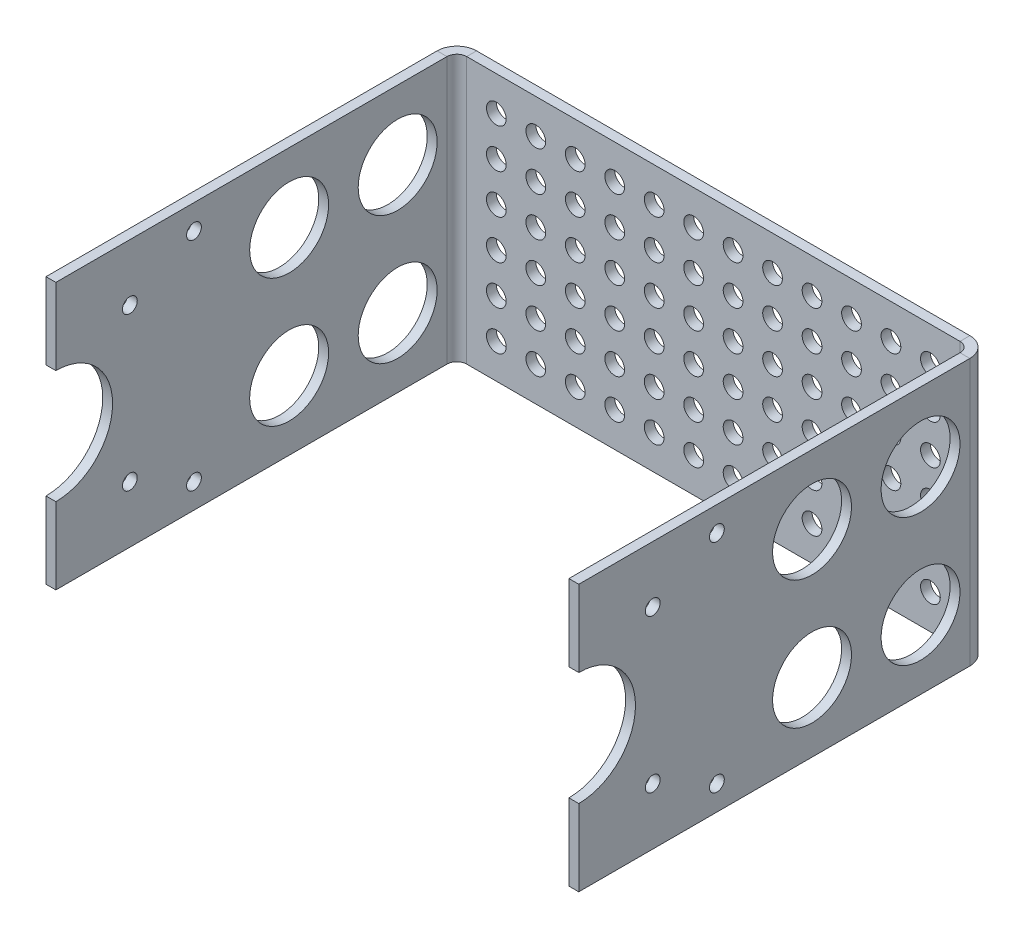
from build123d import *
from build123d.topology import SkipClean

# Parameters (mm, degrees)
DODANIE_WYCI_GNI_CIE2_DEPTH = 2
SZKIC_START                 = -29.723292371
SZKIC_ZGI_CIA2_DEPTH        = 54
SZKIC_ZGI_CIA2_2_DEPTH      = 54
SZKIC_START_2               = -53.387814563
SZKIC_ZGI_CIA2_3_DEPTH      = 2
SZKIC_ZGI_CIA3_DEPTH        = 54
SZKIC_ZGI_CIA3_2_DEPTH      = 15.5
SZKIC_START_3               = 8.776707629
SZKIC_ZGI_CIA3_3_DEPTH      = 15.5
SZKIC_START_4               = 50.91654951
SZKIC_ZGI_CIA3_4_DEPTH      = 3.695635927
SZKIC_START_5               = -14.223292371
SZKIC_ZGI_CIA3_5_DEPTH      = 23
SZKIC_ZGI_CIA3_6_DEPTH      = 23
SZKIC15_R                   = 2
WYTNIJ_WYCI_GNI_CIE1_DEPTH  = 103.340806205
SZKIC17_R                   = 8
WYTNIJ_WYCI_GNI_CIE2_DEPTH  = 140.586175041
SZKIC18_R                   = 1.5
WYTNIJ_WYCI_GNI_CIE3_DEPTH  = 140.586175041


with BuildPart() as part:
    # Szkic1 → Dodanie-wyciągnięcie2 (new body)
    with BuildSketch(Plane.XY):
        with BuildLine():
            Line((-133.387814563, 24.276707629), (-133.387814563, 8.776707629))
            ThreePointArc((-133.387814563, 8.776707629), (-121.887814563, -2.723292371), (-133.387814563, -14.223292371))
            Line((-133.387814563, -14.223292371), (-133.387814563, -29.723292371))
            Line((-133.387814563, -29.723292371), (134.612185437, -29.723292371))
            Line((134.612185437, -29.723292371), (134.612185437, -14.223292371))
            ThreePointArc((134.612185437, -14.223292371), (123.112185437, -2.723292371), (134.612185437, 8.776707629))
            Line((134.612185437, 8.776707629), (134.612185437, 24.276707629))
            Line((134.612185437, 24.276707629), (-133.387814563, 24.276707629))
        make_face()
    extrude(amount=DODANIE_WYCI_GNI_CIE2_DEPTH)

    # Szkic zgięcia2: read off the stored shape, not the designer's step
    # Szkic zgięcia2 outline → Szkic zgięcia2 (cut)
    with BuildSketch(Plane(origin=(0, 0, 0), x_dir=(1, 0, 0), z_dir=(0, 1, 0)).offset(SZKIC_START)):
        with BuildLine():
            Line((-133.387814563, -2), (-52.851916179, -2))
            ThreePointArc((-52.851916179, -2), (-51.387814563, -0.535898385), (-49.387814563, 0))
            Line((-49.387814563, 0), (-133.387814563, 0))
            Line((-133.387814563, 0), (-133.387814563, -2))
        make_face()
    extrude(amount=SZKIC_ZGI_CIA2_DEPTH, mode=Mode.SUBTRACT)

    # Szkic zgi_cia2 2 outline → Szkic zgi_cia2 2 (add)
    with BuildSketch(Plane(origin=(0, 0, 0), x_dir=(1, 0, 0), z_dir=(0, 1, 0)).offset(SZKIC_START)):
        with BuildLine():
            Line((-53.387814563, -83.28761102), (-51.387814563, -83.28761102))
            Line((-51.387814563, -83.28761102), (-51.387814563, -4))
            ThreePointArc((-51.387814563, -4), (-50.802028126, -2.585786437), (-49.387814563, -2))
            Line((-49.387814563, -2), (-52.851916179, -2))
            ThreePointArc((-52.851916179, -2), (-53.251517868, -2.96472382), (-53.387814563, -4))
            Line((-53.387814563, -4), (-53.387814563, -83.28761102))
        make_face()
    extrude(amount=SZKIC_ZGI_CIA2_2_DEPTH)

    # Szkic zgi_cia2 3 outline → Szkic zgi_cia2 3 (cut)
    with BuildSketch(Plane.YZ.offset(SZKIC_START_2)):
        with BuildLine():
            ThreePointArc((-14.223292371, 83.28761102), (-2.723292371, 71.78761102), (8.776707629, 83.28761102))
            Line((8.776707629, 83.28761102), (-14.223292371, 83.28761102))
        make_face()
    extrude(amount=SZKIC_ZGI_CIA2_3_DEPTH, mode=Mode.SUBTRACT)

    # Szkic zgięcia3: read off the stored shape, not the designer's step
    # Szkic zgięcia3 outline → Szkic zgięcia3 (cut)
    with BuildSketch(Plane(origin=(0, 0, 0), x_dir=(1, 0, 0), z_dir=(0, 1, 0)).offset(SZKIC_START)):
        with BuildLine():
            ThreePointArc((50.612185437, 0), (52.612185437, -0.535898385), (54.076287052, -2))
            Line((54.076287052, -2), (134.612185437, -2))
            Line((134.612185437, -2), (134.612185437, 0))
            Line((134.612185437, 0), (50.612185437, 0))
        make_face()
    extrude(amount=SZKIC_ZGI_CIA3_DEPTH, mode=Mode.SUBTRACT)

    # Szkic zgi_cia3 2 outline → Szkic zgi_cia3 2 (add)
    with BuildSketch(Plane(origin=(0, 0, 0), x_dir=(1, 0, 0), z_dir=(0, 1, 0)).offset(SZKIC_START)):
        with BuildLine():
            Line((52.612185437, -4), (52.612185437, -83.28761102))
            Line((52.612185437, -83.28761102), (54.612185437, -83.28761102))
            Line((54.612185437, -83.28761102), (54.612185437, -4))
            ThreePointArc((54.612185437, -4), (54.475888742, -2.96472382), (54.076287052, -2))
            Line((54.076287052, -2), (50.612185437, -2))
            ThreePointArc((50.612185437, -2), (52.026398999, -2.585786438), (52.612185437, -4))
        make_face()
    extrude(amount=SZKIC_ZGI_CIA3_2_DEPTH)

    # Szkic zgi_cia3 3 outline → Szkic zgi_cia3 3 (add)
    with BuildSketch(Plane(origin=(0, 0, 0), x_dir=(1, 0, 0), z_dir=(0, 1, 0)).offset(SZKIC_START_3)):
        with BuildLine():
            Line((52.612185437, -4), (52.612185437, -83.28761102))
            Line((52.612185437, -83.28761102), (54.612185437, -83.28761102))
            Line((54.612185437, -83.28761102), (54.612185437, -4))
            ThreePointArc((54.612185437, -4), (54.475888742, -2.96472382), (54.076287052, -2))
            Line((54.076287052, -2), (50.612185437, -2))
            ThreePointArc((50.612185437, -2), (52.026398999, -2.585786438), (52.612185437, -4))
        make_face()
    extrude(amount=SZKIC_ZGI_CIA3_3_DEPTH)

    # Szkic zgi_cia3 4 outline → Szkic zgi_cia3 4 (add)
    with BuildSketch(Plane.YZ.offset(SZKIC_START_4)):
        with BuildLine():
            ThreePointArc((8.776707629, 83.28761102), (-2.723292371, 71.78761102), (-14.223292371, 83.28761102))
            Line((-14.223292371, 83.28761102), (-14.223292371, 2))
            Line((-14.223292371, 2), (8.776707629, 2))
            Line((8.776707629, 2), (8.776707629, 83.28761102))
        make_face()
    extrude(amount=SZKIC_ZGI_CIA3_4_DEPTH)

    # Szkic zgi_cia3 5 outline → Szkic zgi_cia3 5 (cut)
    with SkipClean():  # the faces are left unmerged after this step: merging them gives an invalid solid
        with BuildSketch(Plane(origin=(0, 0, 0), x_dir=(1, 0, 0), z_dir=(0, 1, 0)).offset(SZKIC_START_5)):
            with BuildLine():
                Line((52.612185437, -85), (52.612185437, -4))
                ThreePointArc((52.612185437, -4), (52.130198636, -2.69783414), (50.91654951, -2.023295037))
                Line((50.91654951, -2.023295037), (50.91654951, -85))
                Line((50.91654951, -85), (52.612185437, -85))
            make_face()
            with BuildLine():
                Line((56, -2), (54.076287052, -2))
                ThreePointArc((54.076287052, -2), (54.475888742, -2.96472382), (54.612185437, -4))
                Line((54.612185437, -4), (54.612185454, -85))
                Line((54.612185454, -85), (56, -85))
                Line((56, -85), (56, -2))
            make_face()
        extrude(amount=SZKIC_ZGI_CIA3_5_DEPTH, mode=Mode.SUBTRACT)

    # Szkic zgi_cia3 6 outline → Szkic zgi_cia3 6 (add)
    with SkipClean():  # the faces are left unmerged after this step: merging them gives an invalid solid
        with BuildSketch(Plane(origin=(0, 0, 0), x_dir=(1, 0, 0), z_dir=(0, 1, 0)).offset(SZKIC_START_5)):
            with BuildLine():
                ThreePointArc((50.612185437, -2), (50.764812554, -2.005832263), (50.91654951, -2.023295037))
                Line((50.91654951, -2.023295037), (50.91654951, -2))
                Line((50.91654951, -2), (50.612185437, -2))
            make_face()
        extrude(amount=SZKIC_ZGI_CIA3_6_DEPTH)

    # Szkic15 → Wytnij-wyciągnięcie1 (cut, through all)
    with SkipClean():  # the faces are left unmerged after this step: merging them gives an invalid solid
        with BuildSketch(Plane.XY.offset(2)):
            with Locations((-43.387814563, 17.276707629)):
                Circle(SZKIC15_R)
            with Locations((-35.387814563, 17.276707629)):
                Circle(SZKIC15_R)
            with Locations((-27.387814563, 17.276707629)):
                Circle(SZKIC15_R)
            with Locations((-19.387814563, 17.276707629)):
                Circle(SZKIC15_R)
            with Locations((-11.387814563, 17.276707629)):
                Circle(SZKIC15_R)
            with Locations((-3.387814563, 17.276707629)):
                Circle(SZKIC15_R)
            with Locations((4.612185437, 17.276707629)):
                Circle(SZKIC15_R)
            with Locations((12.612185437, 17.276707629)):
                Circle(SZKIC15_R)
            with Locations((20.612185437, 17.276707629)):
                Circle(SZKIC15_R)
            with Locations((28.612185437, 17.276707629)):
                Circle(SZKIC15_R)
            with Locations((36.612185437, 17.276707629)):
                Circle(SZKIC15_R)
            with Locations((44.612185437, 17.276707629)):
                Circle(SZKIC15_R)
            with Locations((-35.387814563, 9.276707629)):
                Circle(SZKIC15_R)
            with Locations((-27.387814563, 9.276707629)):
                Circle(SZKIC15_R)
            with Locations((-19.387814563, 9.276707629)):
                Circle(SZKIC15_R)
            with Locations((-11.387814563, 9.276707629)):
                Circle(SZKIC15_R)
            with Locations((-3.387814563, 9.276707629)):
                Circle(SZKIC15_R)
            with Locations((4.612185437, 9.276707629)):
                Circle(SZKIC15_R)
            with Locations((12.612185437, 9.276707629)):
                Circle(SZKIC15_R)
            with Locations((20.612185437, 9.276707629)):
                Circle(SZKIC15_R)
            with Locations((28.612185437, 9.276707629)):
                Circle(SZKIC15_R)
            with Locations((36.612185437, 9.276707629)):
                Circle(SZKIC15_R)
            with Locations((44.612185437, 9.276707629)):
                Circle(SZKIC15_R)
            with Locations((-35.387814563, 1.276707629)):
                Circle(SZKIC15_R)
            with Locations((-27.387814563, 1.276707629)):
                Circle(SZKIC15_R)
            with Locations((-19.387814563, 1.276707629)):
                Circle(SZKIC15_R)
            with Locations((-11.387814563, 1.276707629)):
                Circle(SZKIC15_R)
            with Locations((-3.387814563, 1.276707629)):
                Circle(SZKIC15_R)
            with Locations((4.612185437, 1.276707629)):
                Circle(SZKIC15_R)
            with Locations((12.612185437, 1.276707629)):
                Circle(SZKIC15_R)
            with Locations((20.612185437, 1.276707629)):
                Circle(SZKIC15_R)
            with Locations((28.612185437, 1.276707629)):
                Circle(SZKIC15_R)
            with Locations((36.612185437, 1.276707629)):
                Circle(SZKIC15_R)
            with Locations((44.612185437, 1.276707629)):
                Circle(SZKIC15_R)
            with Locations((-35.387814563, -6.723292371)):
                Circle(SZKIC15_R)
            with Locations((-27.387814563, -6.723292371)):
                Circle(SZKIC15_R)
            with Locations((-19.387814563, -6.723292371)):
                Circle(SZKIC15_R)
            with Locations((-11.387814563, -6.723292371)):
                Circle(SZKIC15_R)
            with Locations((-3.387814563, -6.723292371)):
                Circle(SZKIC15_R)
            with Locations((4.612185437, -6.723292371)):
                Circle(SZKIC15_R)
            with Locations((12.612185437, -6.723292371)):
                Circle(SZKIC15_R)
            with Locations((20.612185437, -6.723292371)):
                Circle(SZKIC15_R)
            with Locations((28.612185437, -6.723292371)):
                Circle(SZKIC15_R)
            with Locations((36.612185437, -6.723292371)):
                Circle(SZKIC15_R)
            with Locations((44.612185437, -6.723292371)):
                Circle(SZKIC15_R)
            with Locations((-35.387814563, -14.723292371)):
                Circle(SZKIC15_R)
            with Locations((-27.387814563, -14.723292371)):
                Circle(SZKIC15_R)
            with Locations((-19.387814563, -14.723292371)):
                Circle(SZKIC15_R)
            with Locations((-11.387814563, -14.723292371)):
                Circle(SZKIC15_R)
            with Locations((-3.387814563, -14.723292371)):
                Circle(SZKIC15_R)
            with Locations((4.612185437, -14.723292371)):
                Circle(SZKIC15_R)
            with Locations((12.612185437, -14.723292371)):
                Circle(SZKIC15_R)
            with Locations((20.612185437, -14.723292371)):
                Circle(SZKIC15_R)
            with Locations((28.612185437, -14.723292371)):
                Circle(SZKIC15_R)
            with Locations((36.612185437, -14.723292371)):
                Circle(SZKIC15_R)
            with Locations((44.612185437, -14.723292371)):
                Circle(SZKIC15_R)
            with Locations((-35.387814563, -22.723292371)):
                Circle(SZKIC15_R)
            with Locations((-27.387814563, -22.723292371)):
                Circle(SZKIC15_R)
            with Locations((-19.387814563, -22.723292371)):
                Circle(SZKIC15_R)
            with Locations((-11.387814563, -22.723292371)):
                Circle(SZKIC15_R)
            with Locations((-3.387814563, -22.723292371)):
                Circle(SZKIC15_R)
            with Locations((4.612185437, -22.723292371)):
                Circle(SZKIC15_R)
            with Locations((12.612185437, -22.723292371)):
                Circle(SZKIC15_R)
            with Locations((20.612185437, -22.723292371)):
                Circle(SZKIC15_R)
            with Locations((28.612185437, -22.723292371)):
                Circle(SZKIC15_R)
            with Locations((36.612185437, -22.723292371)):
                Circle(SZKIC15_R)
            with Locations((44.612185437, -22.723292371)):
                Circle(SZKIC15_R)
            with Locations((-43.387814563, 9.276707629)):
                Circle(SZKIC15_R)
            with Locations((-43.387814563, 1.276707629)):
                Circle(SZKIC15_R)
            with Locations((-43.387814563, -6.723292371)):
                Circle(SZKIC15_R)
            with Locations((-43.387814563, -14.723292371)):
                Circle(SZKIC15_R)
            with Locations((-43.387814563, -22.723292371)):
                Circle(SZKIC15_R)
        extrude(amount=-WYTNIJ_WYCI_GNI_CIE1_DEPTH, mode=Mode.SUBTRACT)

    # Szkic17 → Wytnij-wyciągnięcie2 (cut, through all)
    with SkipClean():  # the faces are left unmerged after this step: merging them gives an invalid solid
        with BuildSketch(Plane.ZY.offset(53.387814563)):
            with Locations((14, 10.276707629)):
                Circle(SZKIC17_R)
            with Locations((36, 10.276707629)):
                Circle(SZKIC17_R)
            with Locations((36, -15.723292371)):
                Circle(SZKIC17_R)
            with Locations((14, -15.723292371)):
                Circle(SZKIC17_R)
        extrude(amount=-WYTNIJ_WYCI_GNI_CIE2_DEPTH, mode=Mode.SUBTRACT)

    # Szkic18 → Wytnij-wyciągnięcie3 (cut, through all)
    with SkipClean():  # the faces are left unmerged after this step: merging them gives an invalid solid
        with BuildSketch(Plane.ZY.offset(53.387814563)):
            with Locations((68.28761102, 12.776707629)):
                Circle(SZKIC18_R)
            with Locations((68.28761102, -18.223292371)):
                Circle(SZKIC18_R)
            with Locations((55.28761102, 19.276707629)):
                Circle(SZKIC18_R)
            with Locations((55.28761102, -24.723292371)):
                Circle(SZKIC18_R)
        extrude(amount=-WYTNIJ_WYCI_GNI_CIE3_DEPTH, mode=Mode.SUBTRACT)


solid = part.part
